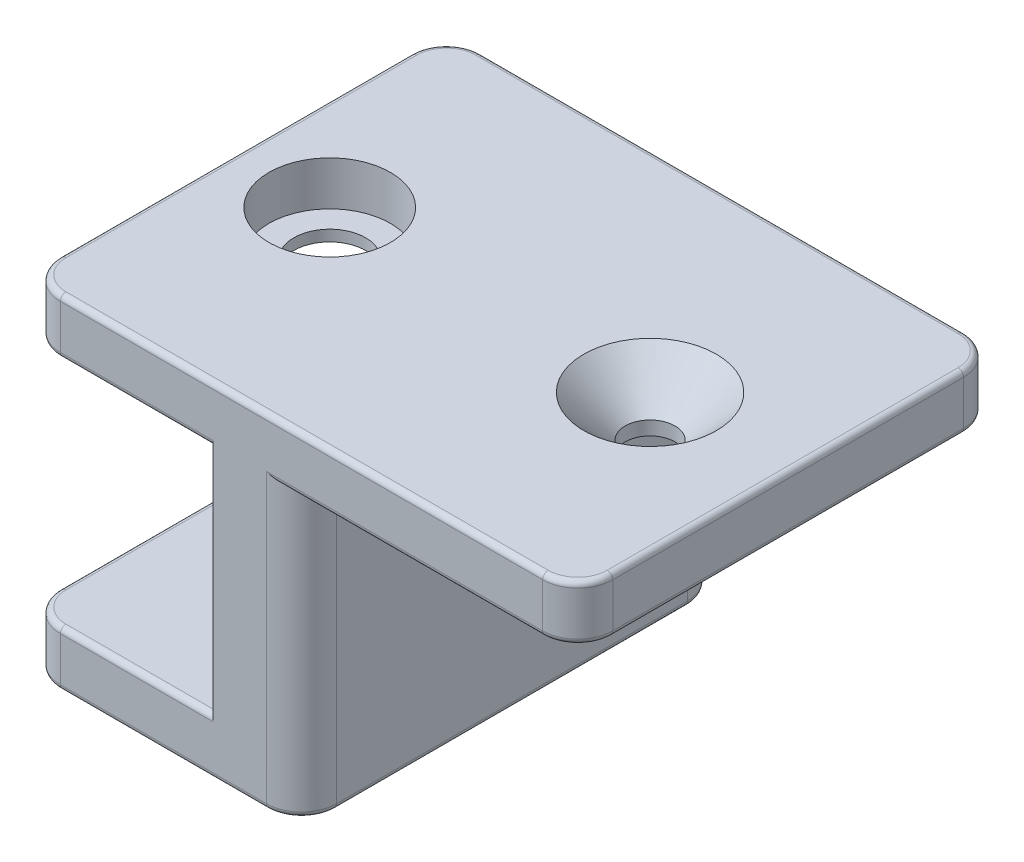
from build123d import *

# Parameters (mm, degrees)
SKETCH1_W           = 25
SKETCH1_H           = 68.1
BOSS_EXTRUDE1_DEPTH = 31.05
CUT_EXTRUDE1_REACH  = 54.426
SKETCH2_W           = 15
SKETCH2_H           = 26.05
SKETCH3_W           = 17
SKETCH3_H           = 21.05
CUT_EXTRUDE2_DEPTH  = 25
SKETCH7_W           = 25
SKETCH7_H           = 38.1
BOSS_EXTRUDE2_DEPTH = 5
SKETCH11_W          = 25
SKETCH11_H          = 15
CUT_EXTRUDE3_DEPTH  = 5
FILLET1_R           = 3.175
FILLET2_R           = 0.5
FILLET3_R           = 3.175


with BuildPart() as part:
    # Sketch1 → Boss-Extrude1 (new body)
    with BuildSketch(Plane(origin=(0, 0, 0), x_dir=(1, 0, 0), z_dir=(0, 1, 0))):
        Rectangle(SKETCH1_W, SKETCH1_H)
    extrude(amount=-BOSS_EXTRUDE1_DEPTH)

    # Sketch2 → Cut-Extrude1 (cut, up to next)
    with BuildSketch(Plane(origin=(12.5, 0, 0), x_dir=(0, 0, -1), z_dir=(1, 0, 0)), mode=Mode.PRIVATE) as cut_extrude1_sk1:
        with Locations((-26.55, -18.025)):
            Rectangle(SKETCH2_W, SKETCH2_H)
    cut_extrude1_tool1 = extrude(cut_extrude1_sk1.sketch, amount=-CUT_EXTRUDE1_REACH, mode=Mode.PRIVATE) & part.part
    # Sketch2 → Cut-Extrude1 (cut, up to next)
    with BuildSketch(Plane(origin=(12.5, 0, 0), x_dir=(0, 0, -1), z_dir=(1, 0, 0)), mode=Mode.PRIVATE) as cut_extrude1_sk2:
        with Locations((26.55, -18.025)):
            Rectangle(SKETCH2_W, SKETCH2_H)
    cut_extrude1_tool2 = extrude(cut_extrude1_sk2.sketch, amount=-CUT_EXTRUDE1_REACH, mode=Mode.PRIVATE) & part.part
    add(cut_extrude1_tool1.solids().sort_by_distance((12.5, -18.025, 26.55))[0], mode=Mode.SUBTRACT)
    add(cut_extrude1_tool2.solids().sort_by_distance((12.5, -18.025, -26.55))[0], mode=Mode.SUBTRACT)

    # Sketch3 → Cut-Extrude2 (cut, symmetric)
    with BuildSketch(Plane.XY):
        with Locations((-4, -15.525)):
            Rectangle(SKETCH3_W, SKETCH3_H)
    extrude(amount=CUT_EXTRUDE2_DEPTH, both=True, mode=Mode.SUBTRACT)

    # Sketch6 → Cut-Revolve2 (revolve, cut)
    with BuildSketch(Plane.XY, mode=Mode.PRIVATE) as cut_revolve2_sk:
        Polygon((-4, 0), (-4, -5), (-0.75, -5), (-0.75, -4), (1.5, -4), (1.5, 0), align=None)
    revolve(cut_revolve2_sk.sketch.rotate(Axis((-4, 0, 0), (0, -1, 0)), 180), axis=Axis((-4, 0, 0), (0, -1, 0)), mode=Mode.SUBTRACT)

    # Sketch7 → Boss-Extrude2 (add)
    with BuildSketch(Plane(origin=(0, 0, 0), x_dir=(1, 0, 0), z_dir=(0, 1, 0))):
        with Locations((25, 0)):
            Rectangle(SKETCH7_W, SKETCH7_H)
    extrude(amount=-BOSS_EXTRUDE2_DEPTH)

    # Sketch10 → Cut-Revolve3 (revolve, cut)
    with BuildSketch(Plane.XY, mode=Mode.PRIVATE) as cut_revolve3_sk:
        Polygon((25, 0), (19, 0), (22.75, -3.75), (22.75, -5), (25, -5), align=None)
    revolve(cut_revolve3_sk.sketch.rotate(Axis((25, -5, 0), (0, 1, 0)), 270), axis=Axis((25, -5, 0), (0, 1, 0)), mode=Mode.SUBTRACT)

    # Sketch11 → Cut-Extrude3 (cut)
    with BuildSketch(Plane(origin=(0, 0, 0), x_dir=(1, 0, 0), z_dir=(0, 1, 0))):
        with Locations((0, 26.55)):
            Rectangle(SKETCH11_W, SKETCH11_H)
        with Locations((0, -26.55)):
            Rectangle(SKETCH11_W, SKETCH11_H)
    extrude(amount=-CUT_EXTRUDE3_DEPTH, mode=Mode.SUBTRACT)

    # Fillet1
    fillet1_edges = [part.edges().sort_by_distance(p)[0] for p in [
        (12.5, -18.025, 19.05),
        (12.5, -18.025, -19.05),
    ]]
    fillet(fillet1_edges, radius=FILLET1_R)

    # Fillet2
    fillet2_edges = [part.edges().sort_by_distance(p)[0] for p in [
        (-4, -5, 19.05),
        (12.5, -31.05, 0),
        (11.57006403, -31.05, -18.12006403),
        (11.57006403, -31.05, 18.12006403),
        (-12.5, -31.05, 0),
        (-1.5875, -31.05, 19.05),
        (-1.5875, -31.05, -19.05),
        (-4, -26.05, 19.05),
        (-12.5, -26.05, 0),
        (-4, -26.05, -19.05),
        (12.5, 0, -19.05),
        (12.5, 0, 19.05),
        (37.5, 0, 0),
        (23.4125, -5, -19.05),
        (37.5, -5, 0),
        (23.4125, -5, 19.05),
        (-12.5, -5, 0),
        (-4, -5, -19.05),
        (-12.5, 0, 0),
    ]]
    fillet(fillet2_edges, radius=FILLET2_R)

    # Fillet3
    # the kernel refuses this fillet: 3.175 mm, written as the material it takes off along each edge
    with BuildSketch(Plane(origin=(-9.325, -31.05, -15.875), x_dir=(-1, 0, 0), z_dir=(0, 0, 1))) as fillet3_piece_1:
        with BuildLine():
            CenterArc((2.675, -0.5), 0.5, 0, 90)
            Line((3.175, -0.5), (3.175, 0))
            Line((3.175, 0), (2.675, 0))
        make_face()
    revolve(axis=Axis((-9.325, -31.05, -15.875), (0, -1, 0)), revolution_arc=90, mode=Mode.SUBTRACT)
    with BuildSketch(Plane(origin=(-9.325, -31.05, 15.875), x_dir=(0, 0, 1), z_dir=(1, 0, 0))) as fillet3_piece_2:
        with BuildLine():
            CenterArc((2.675, -0.5), 0.5, 0, 90)
            Line((3.175, -0.5), (3.175, 0))
            Line((3.175, 0), (2.675, 0))
        make_face()
    revolve(axis=Axis((-9.325, -31.05, 15.875), (0, -1, 0)), revolution_arc=90, mode=Mode.SUBTRACT)
    with BuildSketch(Plane(origin=(-9.325, -26.05, -15.875), x_dir=(0, 0, -1), z_dir=(1, 0, 0))) as fillet3_piece_3:
        with BuildLine():
            CenterArc((2.675, -0.5), 0.5, 0, 90)
            Line((3.175, -0.5), (3.175, 0))
            Line((3.175, 0), (2.675, 0))
        make_face()
    revolve(axis=Axis((-9.325, -26.05, -15.875), (0, 1, 0)), revolution_arc=90, mode=Mode.SUBTRACT)
    with BuildSketch(Plane(origin=(-9.325, -26.05, 15.875), x_dir=(-1, 0, 0), z_dir=(0, 0, -1))) as fillet3_piece_4:
        with BuildLine():
            CenterArc((2.675, -0.5), 0.5, 0, 90)
            Line((3.175, -0.5), (3.175, 0))
            Line((3.175, 0), (2.675, 0))
        make_face()
    revolve(axis=Axis((-9.325, -26.05, 15.875), (0, 1, 0)), revolution_arc=90, mode=Mode.SUBTRACT)
    with BuildSketch(Plane(origin=(-9.325, 0, 15.875), x_dir=(-1, 0, 0), z_dir=(0, 0, -1))) as fillet3_piece_5:
        with BuildLine():
            CenterArc((2.675, -0.5), 0.5, 0, 90)
            Line((3.175, -0.5), (3.175, 0))
            Line((3.175, 0), (2.675, 0))
        make_face()
    revolve(axis=Axis((-9.325, 0, 15.875), (0, 1, 0)), revolution_arc=90, mode=Mode.SUBTRACT)
    with BuildSketch(Plane(origin=(-9.325, 0, -15.875), x_dir=(0, 0, -1), z_dir=(1, 0, 0))) as fillet3_piece_6:
        with BuildLine():
            CenterArc((2.675, -0.5), 0.5, 0, 90)
            Line((3.175, -0.5), (3.175, 0))
            Line((3.175, 0), (2.675, 0))
        make_face()
    revolve(axis=Axis((-9.325, 0, -15.875), (0, 1, 0)), revolution_arc=90, mode=Mode.SUBTRACT)
    with BuildSketch(Plane(origin=(34.325, 0, 15.875), x_dir=(0, 0, 1), z_dir=(-1, 0, 0))) as fillet3_piece_7:
        with BuildLine():
            CenterArc((2.675, -0.5), 0.5, 0, 90)
            Line((3.175, -0.5), (3.175, 0))
            Line((3.175, 0), (2.675, 0))
        make_face()
    revolve(axis=Axis((34.325, 0, 15.875), (0, 1, 0)), revolution_arc=90, mode=Mode.SUBTRACT)
    with BuildSketch(Plane(origin=(34.325, 0, -15.875), x_dir=(1, 0, 0), z_dir=(0, 0, 1))) as fillet3_piece_8:
        with BuildLine():
            CenterArc((2.675, -0.5), 0.5, 0, 90)
            Line((3.175, -0.5), (3.175, 0))
            Line((3.175, 0), (2.675, 0))
        make_face()
    revolve(axis=Axis((34.325, 0, -15.875), (0, 1, 0)), revolution_arc=90, mode=Mode.SUBTRACT)
    with BuildSketch(Plane(origin=(-9.325, -5, 15.875), x_dir=(0, 0, 1), z_dir=(1, 0, 0))) as fillet3_piece_9:
        with BuildLine():
            CenterArc((2.675, -0.5), 0.5, 0, 90)
            Line((3.175, -0.5), (3.175, 0))
            Line((3.175, 0), (2.675, 0))
        make_face()
    revolve(axis=Axis((-9.325, -5, 15.875), (0, -1, 0)), revolution_arc=90, mode=Mode.SUBTRACT)
    with BuildSketch(Plane(origin=(-9.325, -5, -15.875), x_dir=(-1, 0, 0), z_dir=(0, 0, 1))) as fillet3_piece_10:
        with BuildLine():
            CenterArc((2.675, -0.5), 0.5, 0, 90)
            Line((3.175, -0.5), (3.175, 0))
            Line((3.175, 0), (2.675, 0))
        make_face()
    revolve(axis=Axis((-9.325, -5, -15.875), (0, -1, 0)), revolution_arc=90, mode=Mode.SUBTRACT)
    with BuildSketch(Plane(origin=(34.325, -5, -15.875), x_dir=(0, 0, -1), z_dir=(-1, 0, 0))) as fillet3_piece_11:
        with BuildLine():
            CenterArc((2.675, -0.5), 0.5, 0, 90)
            Line((3.175, -0.5), (3.175, 0))
            Line((3.175, 0), (2.675, 0))
        make_face()
    revolve(axis=Axis((34.325, -5, -15.875), (0, -1, 0)), revolution_arc=90, mode=Mode.SUBTRACT)
    with BuildSketch(Plane(origin=(34.325, -5, 15.875), x_dir=(1, 0, 0), z_dir=(0, 0, -1))) as fillet3_piece_12:
        with BuildLine():
            CenterArc((2.675, -0.5), 0.5, 0, 90)
            Line((3.175, -0.5), (3.175, 0))
            Line((3.175, 0), (2.675, 0))
        make_face()
    revolve(axis=Axis((34.325, -5, 15.875), (0, -1, 0)), revolution_arc=90, mode=Mode.SUBTRACT)
    with BuildSketch(Plane(origin=(37.5, 0, 19.05), x_dir=(0, 0, -1), z_dir=(0, -1, 0)), Plane(origin=(-12.5, -31.05, 19.05), x_dir=(0, 0, -1), z_dir=(0, 1, 0)), Plane(origin=(-12.5, -31.05, -19.05), x_dir=(1, 0, 0), z_dir=(0, 1, 0)), Plane(origin=(37.5, 0, -19.05), x_dir=(-1, 0, 0), z_dir=(0, -1, 0))) as fillet3_piece_13:
        with BuildLine():
            CenterArc((FILLET3_R, -FILLET3_R), FILLET3_R, 90, 90)
            Line((0, -FILLET3_R), (0, 0))
            Line((0, 0), (FILLET3_R, 0))
        make_face()
    extrude(amount=5, mode=Mode.SUBTRACT)
    with BuildSketch(Plane(origin=(-12.5, 0, 19.05), x_dir=(0, 0, -1), z_dir=(0, -1, 0)), Plane(origin=(-12.5, 0, -19.05), x_dir=(1, 0, 0), z_dir=(0, -1, 0))) as fillet3_piece_14:
        with BuildLine():
            CenterArc((FILLET3_R, FILLET3_R), FILLET3_R, 180, 90)
            Line((0, FILLET3_R), (0, 0))
            Line((0, 0), (FILLET3_R, 0))
        make_face()
    extrude(amount=5, mode=Mode.SUBTRACT)


solid = part.part
